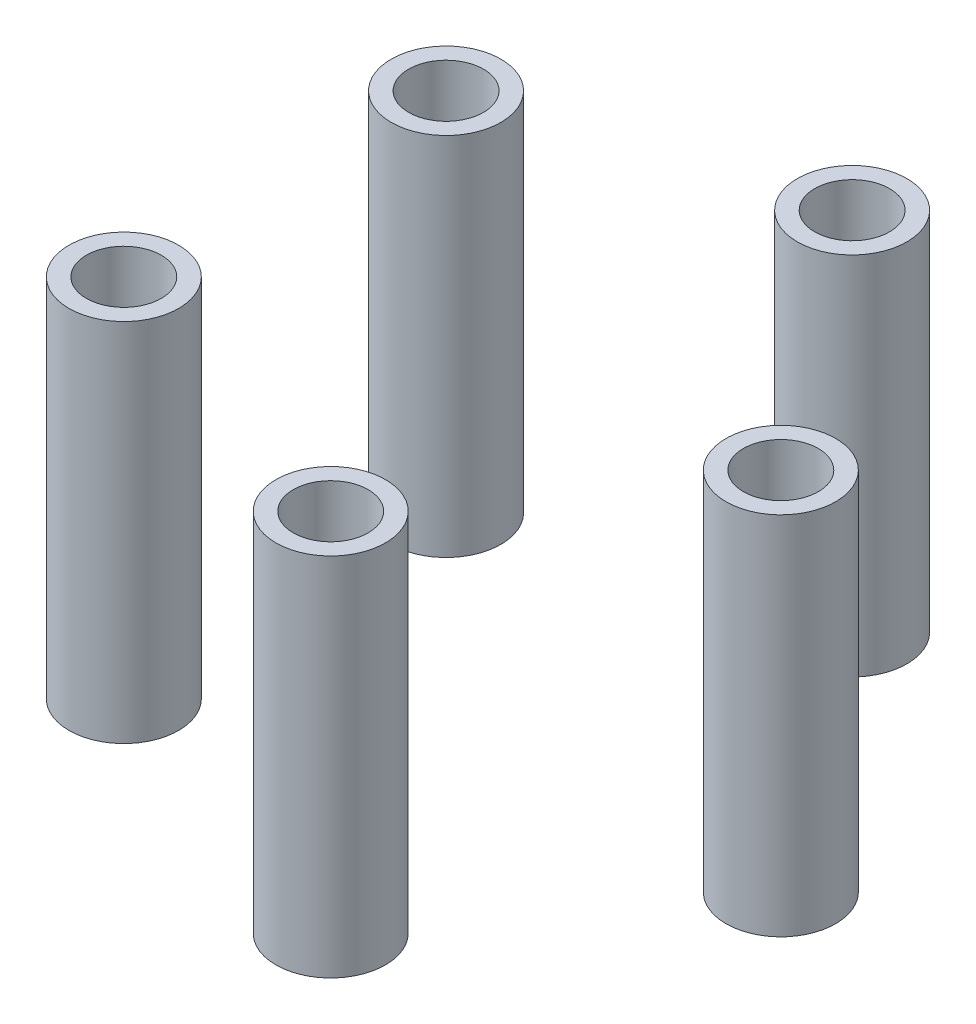
from build123d import *

# Parameters (mm, degrees)
BOSS_EXTRUDE1_DEPTH        = 10
BOSS_EXTRUDE1_DEPTH_BACK   = 10
SKETCH1_R                  = 3
SKETCH1_R_2                = 2.05
BOSS_EXTRUDE1_2_DEPTH      = 10
BOSS_EXTRUDE1_2_DEPTH_BACK = 10
BOSS_EXTRUDE1_3_DEPTH      = 10
BOSS_EXTRUDE1_3_DEPTH_BACK = 10
BOSS_EXTRUDE1_4_DEPTH      = 10
BOSS_EXTRUDE1_4_DEPTH_BACK = 10
BOSS_EXTRUDE1_5_DEPTH      = 10
BOSS_EXTRUDE1_5_DEPTH_BACK = 10


with BuildPart() as part:
    # Sketch1 → Boss-Extrude1 (new, two sides: drawn at the far end of the back side and taken through both)
    with BuildSketch(Plane(origin=(0, 0, 0), x_dir=(1, 0, 0), z_dir=(0, 1, 0)).offset(-BOSS_EXTRUDE1_DEPTH_BACK)):
        with Locations((-12.535254916, -8.814703167)):
            Circle(SKETCH1_R)
        with Locations((-12.535254916, -8.814703167)):
            Circle(SKETCH1_R_2, mode=Mode.SUBTRACT)
    extrude(amount=BOSS_EXTRUDE1_DEPTH + BOSS_EXTRUDE1_DEPTH_BACK)


with BuildPart() as body_2:
    # Sketch1 → Boss-Extrude1 2 (new, two sides: drawn at the far end of the back side and taken through both)
    with BuildSketch(Plane(origin=(0, 0, 0), x_dir=(1, 0, 0), z_dir=(0, 1, 0)).offset(-BOSS_EXTRUDE1_2_DEPTH_BACK)):
        with Locations((4.235254916, -14.263772127)):
            Circle(SKETCH1_R)
        with Locations((4.235254916, -14.263772127)):
            Circle(SKETCH1_R_2, mode=Mode.SUBTRACT)
    extrude(amount=BOSS_EXTRUDE1_2_DEPTH + BOSS_EXTRUDE1_2_DEPTH_BACK)


with BuildPart() as body_3:
    # Sketch1 → Boss-Extrude1 3 (new, two sides: drawn at the far end of the back side and taken through both)
    with BuildSketch(Plane(origin=(0, 0, 0), x_dir=(1, 0, 0), z_dir=(0, 1, 0)).offset(-BOSS_EXTRUDE1_3_DEPTH_BACK)):
        with Locations((14.6, 0.002075618)):
            Circle(SKETCH1_R)
        with Locations((14.6, 0.002075618)):
            Circle(SKETCH1_R_2, mode=Mode.SUBTRACT)
    extrude(amount=BOSS_EXTRUDE1_3_DEPTH + BOSS_EXTRUDE1_3_DEPTH_BACK)


with BuildPart() as body_4:
    # Sketch1 → Boss-Extrude1 4 (new, two sides: drawn at the far end of the back side and taken through both)
    with BuildSketch(Plane(origin=(0, 0, 0), x_dir=(1, 0, 0), z_dir=(0, 1, 0)).offset(-BOSS_EXTRUDE1_4_DEPTH_BACK)):
        with Locations((4.235254916, 14.267923362)):
            Circle(SKETCH1_R)
        with Locations((4.235254916, 14.267923362)):
            Circle(SKETCH1_R_2, mode=Mode.SUBTRACT)
    extrude(amount=BOSS_EXTRUDE1_4_DEPTH + BOSS_EXTRUDE1_4_DEPTH_BACK)


with BuildPart() as body_5:
    # Sketch1 → Boss-Extrude1 5 (new, two sides: drawn at the far end of the back side and taken through both)
    with BuildSketch(Plane(origin=(0, 0, 0), x_dir=(1, 0, 0), z_dir=(0, 1, 0)).offset(-BOSS_EXTRUDE1_5_DEPTH_BACK)):
        with Locations((-12.535254916, 8.818854402)):
            Circle(SKETCH1_R)
        with Locations((-12.535254916, 8.818854402)):
            Circle(SKETCH1_R_2, mode=Mode.SUBTRACT)
    extrude(amount=BOSS_EXTRUDE1_5_DEPTH + BOSS_EXTRUDE1_5_DEPTH_BACK)


solid = Compound([part.part, body_2.part, body_3.part, body_4.part, body_5.part])
